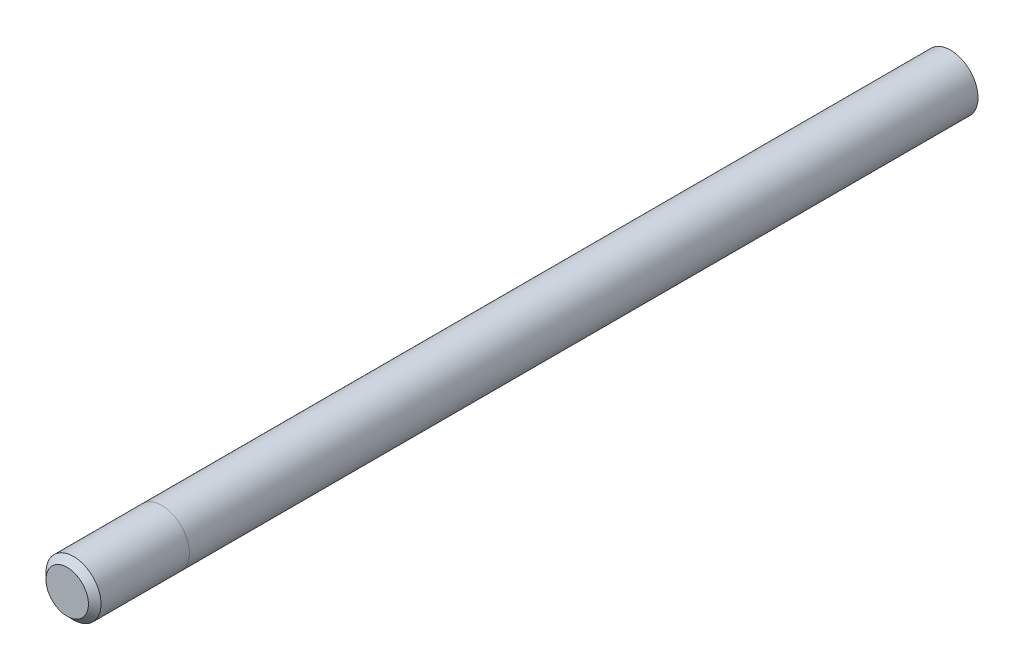
from build123d import *

# Parameters (mm, degrees)
SKETCH1_R           = 5.5372
BOSS_EXTRUDE1_DEPTH = 158.75
SKETCH2_R           = 5.5372
BOSS_EXTRUDE2_DEPTH = 19.05
CHAMFER1_SIZE       = 1.27


with BuildPart() as part:
    # Sketch1 → Boss-Extrude1 (new body)
    with BuildSketch(Plane.XY):
        Circle(SKETCH1_R)
    extrude(amount=BOSS_EXTRUDE1_DEPTH)


with BuildPart() as body_2:
    # Sketch2 → Boss-Extrude2 (new body)
    with BuildSketch(Plane.XY.offset(158.75)):
        Circle(SKETCH2_R)
    extrude(amount=BOSS_EXTRUDE2_DEPTH)

    # Chamfer1
    chamfer1_edges = [body_2.edges().sort_by_distance(p)[0] for p in [
        (-5.5372, 0, 177.8),
    ]]
    chamfer(chamfer1_edges, length=CHAMFER1_SIZE)


solid = Compound([part.part, body_2.part])
